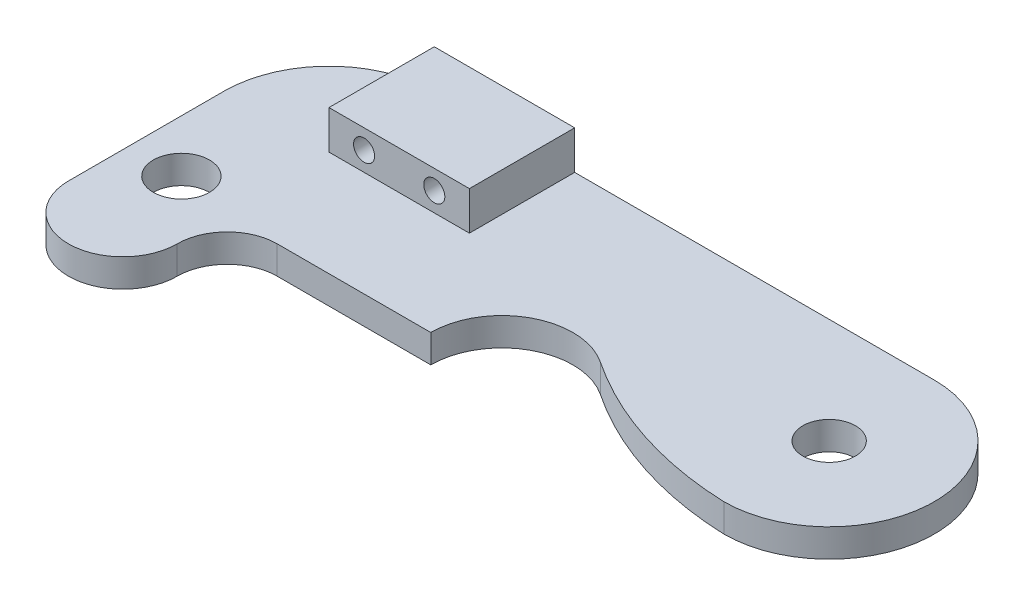
from build123d import *

# Parameters (mm, degrees)
SKETCH1_R           = 1.5
SKETCH1_R_2         = 1.6
BOSS_EXTRUDE1_DEPTH = 1.6
SKETCH2_W           = 8
SKETCH2_H           = 6
BOSS_EXTRUDE2_DEPTH = 2.2
CUT_EXTRUDE1_REACH  = 77.825
SKETCH3_R           = 0.6
FILLET1_R           = 20


with BuildPart() as part:
    # Sketch1 → Boss-Extrude1 (new body)
    with BuildSketch(Plane(origin=(0, 0, 0), x_dir=(1, 0, 0), z_dir=(0, 1, 0))):
        with BuildLine():
            Line((33.072085441, -182.752493772), (33.072085441, -191.652493772))
            ThreePointArc((33.072085441, -191.652493772), (36.172085441, -194.752493772), (39.272085441, -191.652493772))
            ThreePointArc((39.272085441, -191.652493772), (40.106831114, -189.637239445), (42.122085441, -188.802493772))
            Line((42.122085441, -188.802493772), (50.872085441, -188.802493772))
            ThreePointArc((50.872085441, -188.802493772), (54.922085441, -184.752493772), (58.972085441, -188.802493772))
            Line((58.972085441, -188.802493772), (67.571877104, -188.802493772))
            ThreePointArc((67.571877104, -188.802493772), (73.571877104, -182.802493772), (67.571877104, -176.802493772))
            Line((67.571877104, -176.802493772), (39.071877104, -176.802493772))
            ThreePointArc((39.071877104, -176.802493772), (34.846951069, -178.542212091), (33.072085441, -182.752493772))
        make_face()
        with Locations(Location((67.571877104, -182.802493772, 0), (0, 0, 270))):
            Circle(SKETCH1_R, mode=Mode.SUBTRACT)
        with Locations(Location((36.052926365, -188.193770201, 0), (0, 0, 270))):
            Circle(SKETCH1_R_2, mode=Mode.SUBTRACT)
    extrude(amount=BOSS_EXTRUDE1_DEPTH)

    # Sketch2 → Boss-Extrude2 (add)
    with BuildSketch(Plane(origin=(0, 1.6, 0), x_dir=(1, 0, 0), z_dir=(0, 1, 0))):
        with Locations((43.071877104, -179.802493772)):
            Rectangle(SKETCH2_W, SKETCH2_H)
    extrude(amount=BOSS_EXTRUDE2_DEPTH)

    # Sketch3 → Cut-Extrude1 (cut, up to next)
    with BuildSketch(Plane(origin=(0, 0, 176.802493772), x_dir=(-1, 0, 0), z_dir=(0, 0, -1)), mode=Mode.PRIVATE) as cut_extrude1_sk1:
        with Locations((-45.071877104, 2.7)):
            Circle(SKETCH3_R)
    cut_extrude1_tool1 = extrude(cut_extrude1_sk1.sketch, amount=-CUT_EXTRUDE1_REACH, mode=Mode.PRIVATE) & part.part
    # Sketch3 → Cut-Extrude1 (cut, up to next)
    with BuildSketch(Plane(origin=(0, 0, 176.802493772), x_dir=(-1, 0, 0), z_dir=(0, 0, -1)), mode=Mode.PRIVATE) as cut_extrude1_sk2:
        with Locations((-41.071877104, 2.7)):
            Circle(SKETCH3_R)
    cut_extrude1_tool2 = extrude(cut_extrude1_sk2.sketch, amount=-CUT_EXTRUDE1_REACH, mode=Mode.PRIVATE) & part.part
    add(cut_extrude1_tool1.solids().sort_by_distance((45.071877, 2.7, 176.802494))[0], mode=Mode.SUBTRACT)
    add(cut_extrude1_tool2.solids().sort_by_distance((41.071877, 2.7, 176.802494))[0], mode=Mode.SUBTRACT)

    # Fillet1
    # the kernel refuses this fillet: 20 mm, written as the material it takes off along each edge
    with BuildSketch(Plane(origin=(58.972085441, -21.499479158, 188.802493772), x_dir=(-0.47106518434260986, 0, -0.8820984027308195), z_dir=(0, 1, 0))) as fillet1_piece_1:
        with BuildLine():
            CenterArc((13.23693168, -17.641968055), FILLET1_R, 118.103462193, 31.710767892)
            Line((-4.051062445, -7.58586249), (0, 0))
            ThreePointArc((0, 0), (1.907813997, -0.477501469), (3.815627993, 0))
        make_face()
    extrude(amount=44.598958315, mode=Mode.SUBTRACT)


solid = part.part
